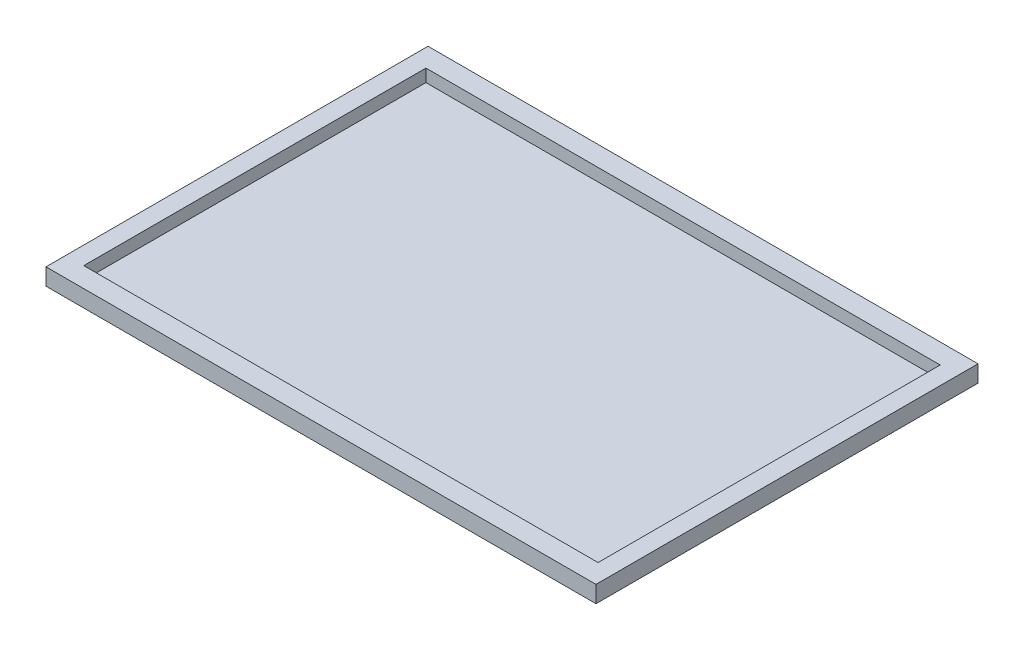
from build123d import *

# Parameters (mm, degrees)
SKETCH1_W           = 131
SKETCH1_H           = 91
BOSS_EXTRUDE1_DEPTH = 4
SKETCH2_W           = 122.5
SKETCH2_H           = 81.5
CUT_EXTRUDE1_DEPTH  = 3


with BuildPart() as part:
    # Sketch1 → Boss-Extrude1 (new body)
    with BuildSketch(Plane(origin=(0, 0, 0), x_dir=(1, 0, 0), z_dir=(0, 1, 0))):
        Rectangle(SKETCH1_W, SKETCH1_H)
    extrude(amount=BOSS_EXTRUDE1_DEPTH)

    # Sketch2 → Cut-Extrude1 (cut)
    with BuildSketch(Plane(origin=(0, 4, 0), x_dir=(1, 0, 0), z_dir=(0, 1, 0))):
        Rectangle(SKETCH2_W, SKETCH2_H)
    extrude(amount=-CUT_EXTRUDE1_DEPTH, mode=Mode.SUBTRACT)


solid = part.part
